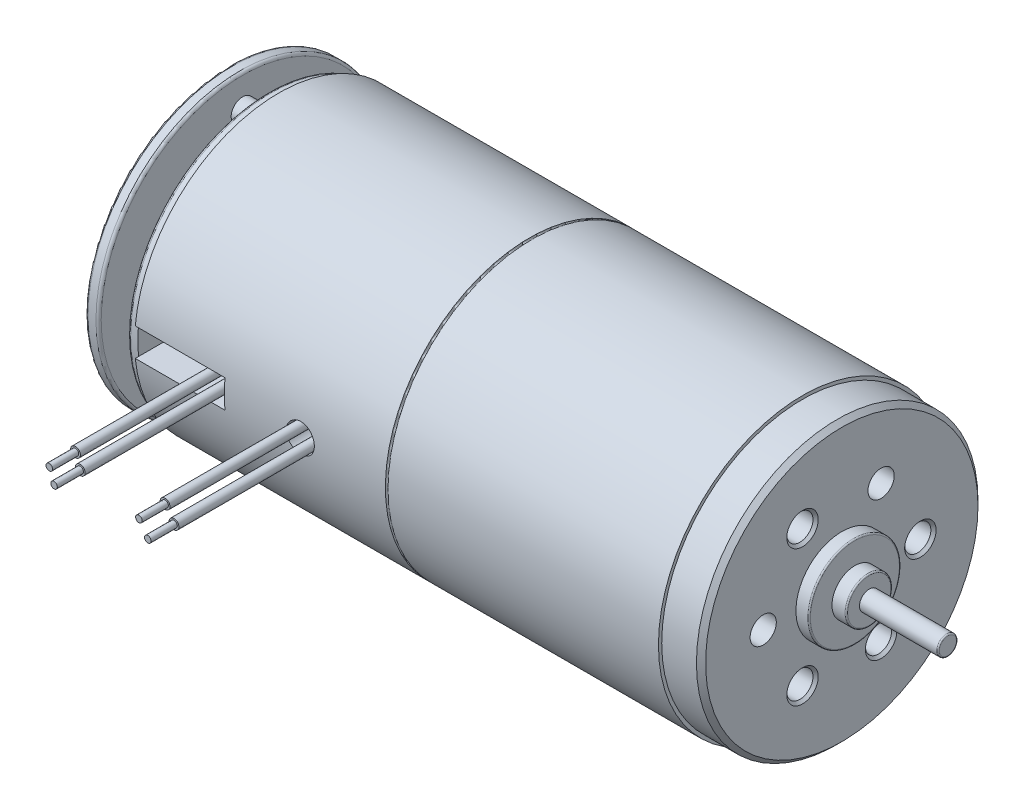
from build123d import *

# Parameters (mm, degrees)
CUT_EXTRUDE1_OUTLINE_W       = 11
CUT_EXTRUDE1_OUTLINE_H       = 1
CUT_EXTRUDE1_2_DEPTH         = 0.75
CUT_EXTRUDE1_START           = -2
CUT_EXTRUDE1_3_OUTLINE_R     = 0.875
CUT_EXTRUDE1_3_DEPTH         = 2
CUT_EXTRUDE2_START           = -6.85
CUT_EXTRUDE2_DEPTH           = 6.85
CUT_EXTRUDE3_START           = -0.75
CUT_EXTRUDE3_DEPTH           = 0.75
SKETCH4_W                    = 6.85
SKETCH4_H                    = 2.15
CUT_EXTRUDE4_DEPTH           = 4.696114949
BOSS_EXTRUDE1_START          = 20.65
SKETCH5_R                    = 11
BOSS_EXTRUDE1_DEPTH          = 20.65
SKETCH6_R                    = 10.75
BOSS_EXTRUDE2_DEPTH          = 3
SKETCH7_R                    = 3.5
BOSS_EXTRUDE3_DEPTH          = 1
SKETCH8_R                    = 1.75
BOSS_EXTRUDE4_DEPTH          = 1.1
SKETCH9_R                    = 0.75
BOSS_EXTRUDE5_DEPTH          = 6
SKETCH10_R                   = 0.375
BOSS_EXTRUDE6_DEPTH          = 15
SKETCH11_R                   = 0.25
BOSS_EXTRUDE7_DEPTH          = 2
SKETCH12_R                   = 0.375
BOSS_EXTRUDE8_DEPTH          = 15
SKETCH13_R                   = 0.25
BOSS_EXTRUDE9_DEPTH          = 2
CUT_EXTRUDE5_REACH           = 57.663
CUT_EXTRUDE5_END_RADIUS      = 11
SKETCH14_R                   = 1.075
SKETCH15_R                   = 0.375
BOSS_EXTRUDE10_DEPTH         = 15
SKETCH16_R                   = 0.25
BOSS_EXTRUDE11_DEPTH         = 2
SKETCH17_R                   = 0.375
BOSS_EXTRUDE12_DEPTH         = 15
SKETCH18_R                   = 0.25
BOSS_EXTRUDE13_DEPTH         = 2
SKETCH19_W                   = 2
SKETCH19_H                   = 0.875
SKETCH20_W                   = 2
SKETCH20_H                   = 0.875
F_2_0_2_DIAMETER_HOLE1_D     = 2
F_2_0_2_DIAMETER_HOLE1_DEPTH = 4
FILLET1_R                    = 0.1
CHAMFER1_SIZE                = 0.2
CHAMFER2_SIZE                = 0.35
FILLET2_R                    = 0.2


with BuildPart() as part:
    # Cut-Extrude1: read off the stored shape, not the designer's step
    # Cut-Extrude1 outline → Cut-Extrude1 (revolve)
    with BuildSketch(Plane.YX):
        with Locations((5.5, -2.5)):
            Rectangle(CUT_EXTRUDE1_OUTLINE_W, CUT_EXTRUDE1_OUTLINE_H)
        with BuildLine():
            Line((11, 0), (11, 19.9))
            ThreePointArc((11, 19.9), (10.9, 20), (11, 20.1))
            Line((11, 20.1), (0, 20.1))
            Line((0, 20.1), (0, 0))
            Line((0, 0), (11, 0))
        make_face()
    revolve(axis=Axis((0, 0, 0), (1, 0, 0)))

    # Cut-Extrude1 2 outline → Cut-Extrude1 2 (cut)
    with BuildSketch(Plane.YZ):
        with BuildLine():
            Line((-1.075, 10.947345569), (-1.075, 10.696114949))
            ThreePointArc((-1.075, 10.696114949), (0, 10.75), (1.075, 10.696114949))
            Line((1.075, 10.696114949), (1.075, 10.947345569))
            ThreePointArc((1.075, 10.947345569), (0, 11), (-1.075, 10.947345569))
        make_face()
    extrude(amount=CUT_EXTRUDE1_2_DEPTH, mode=Mode.SUBTRACT)

    # Cut-Extrude1 3 outline → Cut-Extrude1 3 (add)
    with BuildSketch(Plane.YZ.offset(CUT_EXTRUDE1_START)):
        with Locations((8.5, 0)):
            Circle(CUT_EXTRUDE1_3_OUTLINE_R)
    extrude(amount=CUT_EXTRUDE1_3_DEPTH)

    # Sketch2 → Cut-Extrude2 (cut)
    with BuildSketch(Plane.ZY.offset(-0.75).offset(CUT_EXTRUDE2_START)):
        with BuildLine():
            Line((10.947345569, 1.075), (10.696114949, 1.075))
            Line((10.696114949, 1.075), (10.696114949, -1.075))
            Line((10.696114949, -1.075), (10.947345569, -1.075))
            ThreePointArc((10.947345569, -1.075), (11, 0), (10.947345569, 1.075))
        make_face()
    extrude(amount=CUT_EXTRUDE2_DEPTH, mode=Mode.SUBTRACT)

    # Sketch3 → Cut-Extrude3 (cut)
    with BuildSketch(Plane.ZY.offset(CUT_EXTRUDE3_START)):
        with BuildLine():
            Line((10.696114949, 1.075), (10.947345569, 1.075))
            ThreePointArc((10.947345569, 1.075), (-11, 0), (10.947345569, -1.075))
            Line((10.947345569, -1.075), (10.696114949, -1.075))
            ThreePointArc((10.696114949, -1.075), (-10.75, 0), (10.696114949, 1.075))
        make_face()
    extrude(amount=CUT_EXTRUDE3_DEPTH, mode=Mode.SUBTRACT)

    # Sketch4 → Cut-Extrude4 (cut)
    with BuildSketch(Plane.XY.offset(10.696114949)):
        with Locations((4.175, 0)):
            Rectangle(SKETCH4_W, SKETCH4_H)
    extrude(amount=-CUT_EXTRUDE4_DEPTH, mode=Mode.SUBTRACT)

    # Sketch5 → Boss-Extrude1 (add)
    with BuildSketch(Plane(origin=(20.1, 0, 0), x_dir=(0, 0, -1), z_dir=(1, 0, 0)).offset(BOSS_EXTRUDE1_START)):
        with Locations(Location((0, 0, 0), (0, 0, 180))):
            Circle(SKETCH5_R)
    extrude(amount=-BOSS_EXTRUDE1_DEPTH)

    # Sketch6 → Boss-Extrude2 (add)
    with BuildSketch(Plane(origin=(40.75, 0, 0), x_dir=(0, 0, -1), z_dir=(1, 0, 0))):
        with Locations(Location((0, 0, 0), (0, 0, 174.260829523))):
            Circle(SKETCH6_R)
    extrude(amount=BOSS_EXTRUDE2_DEPTH)

    # Sketch7 → Boss-Extrude3 (add)
    with BuildSketch(Plane(origin=(43.75, 0, 0), x_dir=(0, 0, -1), z_dir=(1, 0, 0))):
        Circle(SKETCH7_R)
    extrude(amount=BOSS_EXTRUDE3_DEPTH)

    # Sketch8 → Boss-Extrude4 (add)
    with BuildSketch(Plane(origin=(44.75, 0, 0), x_dir=(0, 0, -1), z_dir=(1, 0, 0))):
        with Locations(Location((0, 0, 0), (0, 0, 180))):
            Circle(SKETCH8_R)
    extrude(amount=BOSS_EXTRUDE4_DEPTH)

    # Sketch9 → Boss-Extrude5 (add)
    with BuildSketch(Plane(origin=(45.85, 0, 0), x_dir=(0, 0, -1), z_dir=(1, 0, 0))):
        Circle(SKETCH9_R)
    extrude(amount=BOSS_EXTRUDE5_DEPTH)

    # Sketch10 → Boss-Extrude6 (add)
    with BuildSketch(Plane.XY.offset(6)):
        with Locations((6.236029766, 0.5)):
            Circle(SKETCH10_R)
    extrude(amount=BOSS_EXTRUDE6_DEPTH)

    # Sketch11 → Boss-Extrude7 (add)
    with BuildSketch(Plane.XY.offset(21)):
        with Locations((6.236029766, 0.5)):
            Circle(SKETCH11_R)
    extrude(amount=BOSS_EXTRUDE7_DEPTH)

    # Sketch12 → Boss-Extrude8 (add)
    with BuildSketch(Plane.XY.offset(6)):
        with Locations((6.6, -0.5)):
            Circle(SKETCH12_R)
    extrude(amount=BOSS_EXTRUDE8_DEPTH)

    # Sketch13 → Boss-Extrude9 (add)
    with BuildSketch(Plane.XY.offset(21)):
        with Locations((6.6, -0.5)):
            Circle(SKETCH13_R)
    extrude(amount=BOSS_EXTRUDE9_DEPTH)

    # Cut-Extrude5: up to this cylinder (the profile starts inside it)
    cut_extrude5_end = Plane(origin=(13.4, 0, 0), z_dir=(1, 0, 0)) * Cylinder(CUT_EXTRUDE5_END_RADIUS, 138.326, mode=Mode.PRIVATE)
    # Sketch14 → Cut-Extrude5 (cut, up to the surface)
    with BuildSketch(Plane(origin=(0, 0, 6), x_dir=(-1, 0, 0), z_dir=(0, 0, -1)), mode=Mode.PRIVATE) as cut_extrude5_sk1:
        with Locations((-13.4, 0)):
            Circle(SKETCH14_R)
    cut_extrude5_tool1 = extrude(cut_extrude5_sk1.sketch, amount=-CUT_EXTRUDE5_REACH, mode=Mode.PRIVATE) & cut_extrude5_end
    add(cut_extrude5_tool1.solids().sort_by_distance((13.4, 0, 6))[0], mode=Mode.SUBTRACT)

    # Sketch15 → Boss-Extrude10 (add)
    with BuildSketch(Plane.XY.offset(6)):
        with Locations((13.08, 0.5)):
            Circle(SKETCH15_R)
    extrude(amount=BOSS_EXTRUDE10_DEPTH)

    # Sketch16 → Boss-Extrude11 (add)
    with BuildSketch(Plane.XY.offset(21)):
        with Locations((13.08, 0.5)):
            Circle(SKETCH16_R)
    extrude(amount=BOSS_EXTRUDE11_DEPTH)

    # Sketch17 → Boss-Extrude12 (add)
    with BuildSketch(Plane.XY.offset(6)):
        with Locations((13.76, -0.5)):
            Circle(SKETCH17_R)
    extrude(amount=BOSS_EXTRUDE12_DEPTH)

    # Sketch18 → Boss-Extrude13 (add)
    with BuildSketch(Plane.XY.offset(21)):
        with Locations((13.76, -0.5)):
            Circle(SKETCH18_R)
    extrude(amount=BOSS_EXTRUDE13_DEPTH)

    # Sketch19 → Revolve1 (revolve)
    with BuildSketch(Plane(origin=(0, 0, -7.361215932), x_dir=(-1, 0, 0), z_dir=(0, 0, -1)), mode=Mode.PRIVATE) as revolve1_sk:
        with Locations((1, -3.8125)):
            Rectangle(SKETCH19_W, SKETCH19_H)
    revolve(revolve1_sk.sketch.rotate(Axis((0, -4.25, -7.361215932), (-1, 0, 0)), 270), axis=Axis((0, -4.25, -7.361215932), (-1, 0, 0)))

    # Sketch20 → Revolve2 (revolve)
    with BuildSketch(Plane(origin=(0, 0, 7.361215932), x_dir=(-1, 0, 0), z_dir=(0, 0, -1)), mode=Mode.PRIVATE) as revolve2_sk:
        with Locations((1, -3.8125)):
            Rectangle(SKETCH20_W, SKETCH20_H)
    revolve(revolve2_sk.sketch.rotate(Axis((0, -4.25, 7.361215932), (-1, 0, 0)), 270), axis=Axis((0, -4.25, 7.361215932), (-1, 0, 0)))

    # Ø2.0 (2) Diameter Hole1
    with Locations(Plane(origin=(43.75, 0, 0), x_dir=(0, 0, -1), z_dir=(1, 0, 0))):
        with Locations((-3, 5.196152423), (6, 0), (3, -5.196152423), (-3, -5.196152423), (-6, 0), (3, 5.196152423)):
            Hole(F_2_0_2_DIAMETER_HOLE1_D / 2, depth=F_2_0_2_DIAMETER_HOLE1_DEPTH)

    # Fillet1
    fillet1_edges = [part.edges().sort_by_distance(p)[0] for p in [
        (44.75, 0, 3.5),
        (45.85, 0, -1.75),
        (51.85, 0, 0.75),
    ]]
    fillet(fillet1_edges, radius=FILLET1_R)

    # Chamfer1
    chamfer1_edges = [part.edges().sort_by_distance(p)[0] for p in [
        (43.75, -5.196152423, 2),
        (43.75, -5.196152423, -4),
        (43.75, 0, -7),
        (43.75, 5.196152423, 2),
    ]]
    chamfer(chamfer1_edges, length=CHAMFER1_SIZE)

    # Chamfer2
    chamfer2_edges = [part.edges().sort_by_distance(p)[0] for p in [
        (43.75, -1.075, -10.696114949),
    ]]
    chamfer(chamfer2_edges, length=CHAMFER2_SIZE)

    # Fillet2
    fillet2_edges = [part.edges().sort_by_distance(p)[0] for p in [
        (-2, -11, 0),
        (-3, -11, 0),
        (0, 0, -10.75),
    ]]
    fillet(fillet2_edges, radius=FILLET2_R)


solid = part.part
